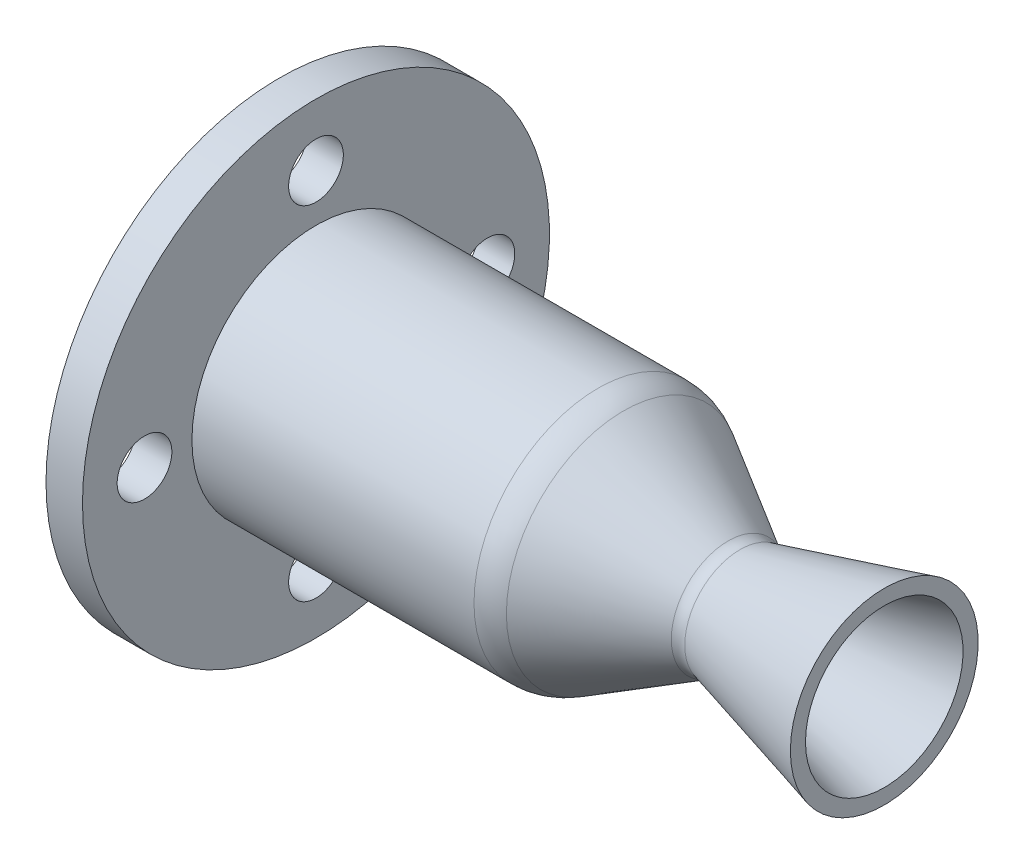
from build123d import *

# Parameters (mm, degrees)
SKETCH2_R          = 9.525
CUT_EXTRUDE1_DEPTH = 240.879490342


with BuildPart() as part:
    # Sketch1 → Revolve1 (revolve)
    with BuildSketch(Plane.XY):
        with BuildLine():
            Line((0, 38.1), (110.897045256, 38.1))
            ThreePointArc((110.897045256, 38.1), (114.184047129, 37.667257994), (117.247045256, 36.398522628))
            Line((117.247045256, 36.398522628), (153.648338424, 15.382226219))
            ThreePointArc((153.648338424, 15.382226219), (157.542961832, 14.060179716), (161.647049978, 14.329175865))
            Line((161.647049978, 14.329175865), (210.545228126, 27.431403211))
            Line((210.545228126, 27.431403211), (210.545228126, 32.690606208))
            Line((210.545228126, 32.690606208), (160.332249229, 19.236079063))
            ThreePointArc((160.332249229, 19.236079063), (158.206034888, 19.096719612), (156.188338424, 19.78163527))
            Line((156.188338424, 19.78163527), (119.787045256, 40.797931679))
            ThreePointArc((119.787045256, 40.797931679), (115.498847878, 42.574161191), (110.897045256, 43.18))
            Line((110.897045256, 43.18), (12.7, 43.18))
            Line((12.7, 43.18), (12.7, 81.28))
            Line((12.7, 81.28), (0, 81.28))
            Line((0, 81.28), (0, 43.18))
            Line((0, 43.18), (0, 38.1))
        make_face()
    revolve(axis=Axis((0, 0, 0), (1, 0, 0)))

    # Sketch2 → Cut-Extrude1 (cut, through all)
    with BuildSketch(Plane.ZY):
        with Locations((-59.69, 0)):
            Circle(SKETCH2_R)
        with Locations((0, 59.69)):
            Circle(SKETCH2_R)
        with Locations((59.69, 0)):
            Circle(SKETCH2_R)
        with Locations((0, -59.69)):
            Circle(SKETCH2_R)
    extrude(amount=-CUT_EXTRUDE1_DEPTH, mode=Mode.SUBTRACT)


solid = part.part
